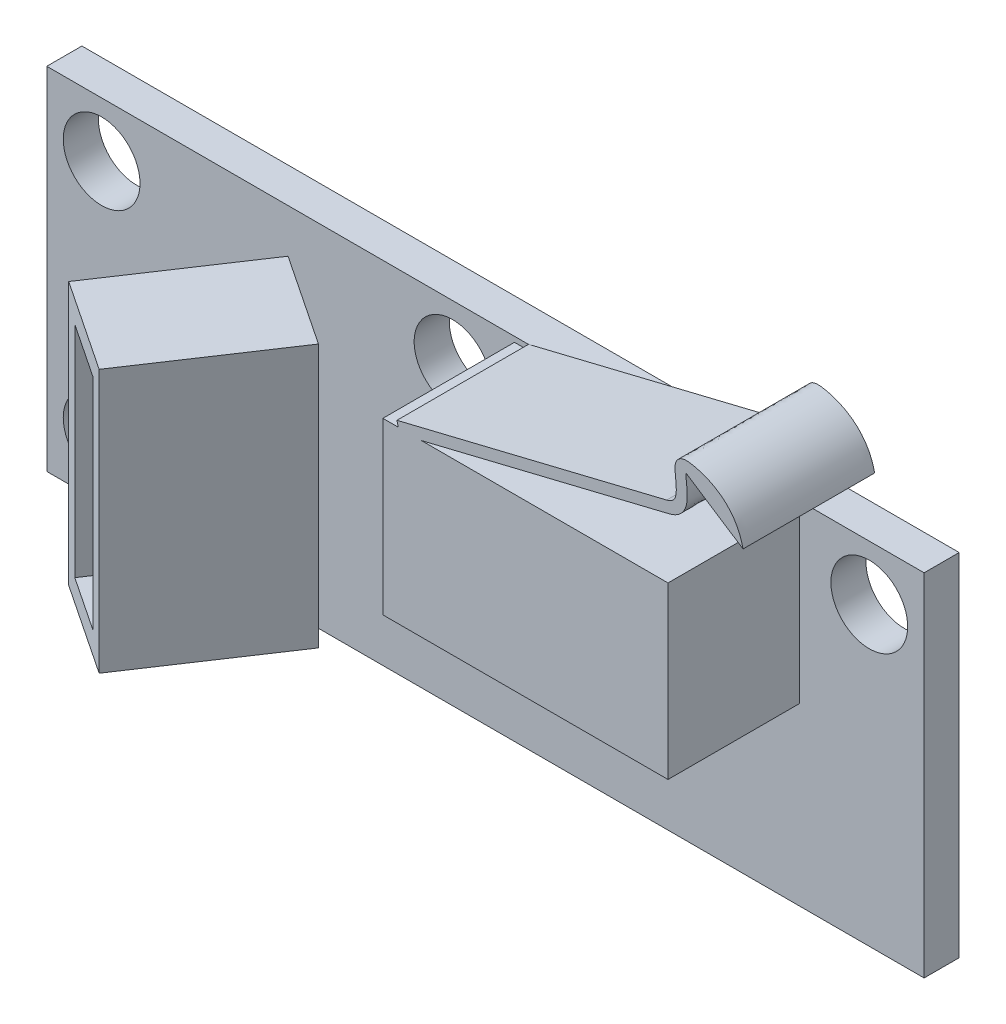
from build123d import *

# Parameters (mm, degrees)
SKETCH1_W           = 40
SKETCH1_H           = 16
SKETCH1_R           = 1.75
EXTRUDE1_DEPTH      = 1.6
SKETCH2_W           = 13
SKETCH2_H           = 7.760900167
EXTRUDE2_DEPTH      = 6
EXTRUDE_THIN1_START = -6
EXTRUDE_THIN1_DEPTH = 6
EXTRUDE3_DEPTH      = 6
EXTRUDE3_DEPTH_BACK = 6
SHELL1_T            = -1
EXTRUDE4_DEPTH      = 6
EXTRUDE4_DEPTH_BACK = 6


# Read off the part's stored shape, not the designer's step: Extrude-Thin1
with BuildPart() as part:
    # Sketch1 → Extrude1 (new body)
    with BuildSketch(Plane.XY):
        Rectangle(SKETCH1_W, SKETCH1_H)
        with Locations((-17.5, 5.5)):
            Circle(SKETCH1_R, mode=Mode.SUBTRACT)
        with Locations(Location((17.5, 5.5, 0), (0, 0, 180))):
            Circle(SKETCH1_R, mode=Mode.SUBTRACT)
        with Locations(Location((-17.5, -5.5, 0), (0, 0, 180))):
            Circle(SKETCH1_R, mode=Mode.SUBTRACT)
        with Locations((-1.5, 5.5)):
            Circle(SKETCH1_R, mode=Mode.SUBTRACT)
    extrude(amount=EXTRUDE1_DEPTH)

    # Sketch2 → Extrude2 (add)
    with BuildSketch(Plane.XY.offset(1.6)):
        with Locations((7.822887278, 3.880450084)):
            Rectangle(SKETCH2_W, SKETCH2_H)
    extrude(amount=EXTRUDE2_DEPTH)

    # Extrude-Thin1 outline → Extrude-Thin1 (add)
    with BuildSketch(Plane.XY.offset(7.6).offset(EXTRUDE_THIN1_START)):
        with BuildLine():
            Line((3.079167928, 7.760900167), (14.382132424, 10.51802157))
            add(Edge.make_bspline(
                [(14.382132424, 10.51802157), (14.527945212, 10.553589545), (14.655507009, 10.60736065), (14.871684027, 10.750671126), (14.959206507, 10.840402341), (15.088857099, 11.037222478), (15.131248766, 11.143247489), (15.184864162, 11.354576745), (15.196559854, 11.46025225), (15.207444647, 11.769684033), (15.183069736, 11.967685168), (15.154835021, 12.22188203), (15.146676484, 12.299323613), (15.139586524, 12.42881224), (15.141421953, 12.481018205), (15.14607356, 12.510227856)],
                knots=[0, 0, 0, 0, 0.125, 0.125, 0.25, 0.25, 0.375, 0.375, 0.5, 0.5, 0.75, 0.75, 0.875, 0.875, 1, 1, 1, 1], degree=3))
            Line((15.14607356, 12.510227856), (17.744563111, 10.812754625))
            add(Edge.make_bspline(
                [(14.263642133, 11.003778764), (14.402173401, 11.037570564), (14.486352869, 11.086615299), (14.60208936, 11.194032624), (14.638108268, 11.255779889), (14.689139196, 11.41869456), (14.700995458, 11.519225736), (14.701883987, 11.741129862), (14.691284391, 11.861642827), (14.665305455, 12.103047364), (14.649847616, 12.223464026), (14.64054286, 12.399920995), (14.639713982, 12.458191462), (14.64847118, 12.576397683), (14.657712888, 12.636731658), (14.701579266, 12.761960135), (14.738209693, 12.82829366), (14.824093983, 12.910144757), (14.857964765, 12.934167296), (14.927645174, 12.970329572), (14.962359684, 12.982536879), (15.06302261, 13.00829889), (15.125868218, 13.011876971), (15.248220417, 13.009575456), (15.30794798, 13.003097855), (15.485077928, 12.976467745), (15.599675402, 12.950856525), (15.836925446, 12.885317177), (15.957201353, 12.844881865), (16.31738791, 12.697890775), (16.556855556, 12.565603074), (17.000758871, 12.217680393), (17.205056858, 12.001744635), (17.539491556, 11.47688197), (17.669190892, 11.168235428), (17.744563111, 10.812754625)],
                knots=[0, 0, 0, 0, 0.0625, 0.0625, 0.125, 0.125, 0.1875, 0.1875, 0.25, 0.25, 0.3125, 0.3125, 0.34375, 0.34375, 0.375, 0.375, 0.40625, 0.40625, 0.421875, 0.421875, 0.4375, 0.4375, 0.46875, 0.46875, 0.5, 0.5, 0.5625, 0.5625, 0.625, 0.625, 0.75, 0.75, 0.875, 0.875, 1, 1, 1, 1], degree=3))
            Line((14.263642133, 11.003778764), (1.96498403, 8.003778764))
            Line((1.96498403, 8.003778764), (2.024229176, 7.760900167))
            Line((2.024229176, 7.760900167), (3.079167928, 7.760900167))
        make_face()
    extrude(amount=EXTRUDE_THIN1_DEPTH)

    # Sketch5 → Extrude4 (add, two sides: drawn at the far end of the back side and taken through both)
    with BuildSketch(Plane(origin=(0, 0, 0), x_dir=(1, 0, 0), z_dir=(0, 1, 0)).offset(-EXTRUDE4_DEPTH_BACK)):
        Polygon((-9.736964899, 0), (-9.458111879, 2), (-8.535084126, 2), (-8.263035101, 0), align=None)
    extrude(amount=EXTRUDE4_DEPTH + EXTRUDE4_DEPTH_BACK)


with BuildPart() as body_2:
    # Sketch4 → Extrude3 (new, two sides: drawn at the far end of the back side and taken through both)
    with BuildSketch(Plane(origin=(0, 0, 0), x_dir=(1, 0, 0), z_dir=(0, 1, 0)).offset(-EXTRUDE3_DEPTH_BACK)):
        Polygon((-13, -7.6), (-9, -1.6), (-4.839748528, -4.373500981), (-8.839748528, -10.373500981), align=None)
    extrude(amount=EXTRUDE3_DEPTH + EXTRUDE3_DEPTH_BACK)

    # Shell1
    shell1_openings = [body_2.faces().sort_by_distance(p)[0] for p in [
        (-10.919874264, 0, 8.986750491),
    ]]
    offset(amount=SHELL1_T, openings=shell1_openings, kind=Kind.INTERSECTION)


solid = Compound([part.part, body_2.part])
